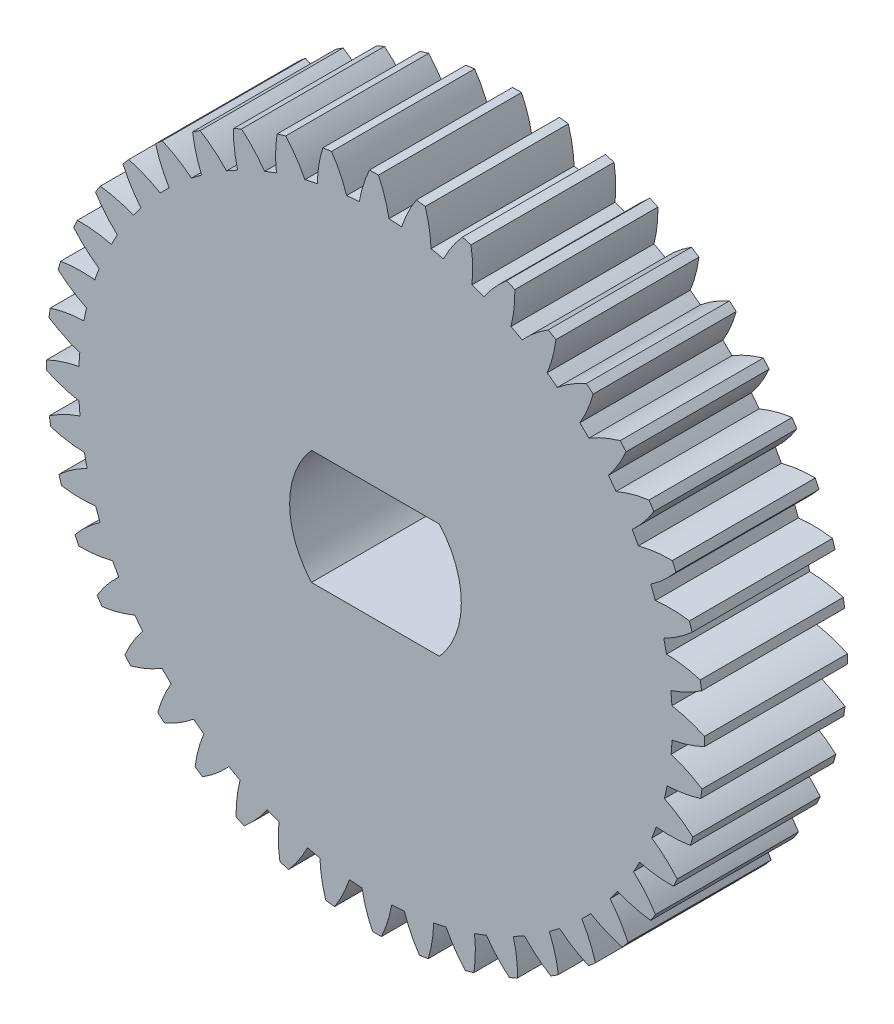
from build123d import *

# Parameters (mm, degrees)
SKETCH1_R               = 57.116275093
BOSS_EXTRUDE1_DEPTH     = 10
CUT_EXTRUDE5_DEPTH      = 305.133463075
CUT_EXTRUDE5_DEPTH_BACK = 305.133463075
SKETCH6_R               = 126.371127407


with BuildPart() as part:
    # Sketch1 → Boss-Extrude1 (new body)
    with BuildSketch(Plane.XY):
        Circle(SKETCH1_R)
    extrude(amount=BOSS_EXTRUDE1_DEPTH)

    # Sketch6 → Cut-Extrude5 (cut, two sides: drawn at the far end of the back side and taken through both)
    # profile 1 of 2: a face of its own
    with BuildSketch(Plane(origin=(-165.342018029, -142.968053491, -44.550276243), x_dir=(1, 0, 0), z_dir=(0, 0, 1)).offset(-CUT_EXTRUDE5_DEPTH_BACK)):
        with Locations((162.765212711, 169.489973714)):
            Circle(SKETCH6_R)
        with BuildLine():
            ThreePointArc((159.697417695, 192.28446063), (160.296052805, 191.248418205), (160.748606807, 190.140743715))
            ThreePointArc((160.748606807, 190.140743715), (161.19067309, 190.179145423), (161.633459483, 190.208085009))
            ThreePointArc((161.633459483, 190.208085009), (161.913174174, 191.371488461), (162.348127806, 192.486191668))
            ThreePointArc((162.348127806, 192.486191668), (162.660372812, 192.489734769), (162.972637144, 192.489038371))
            ThreePointArc((162.972637144, 192.489038371), (163.417734801, 191.378346706), (163.708043941, 190.217541595))
            ThreePointArc((163.708043941, 190.217541595), (164.151075759, 190.192639837), (164.593473758, 190.158269787))
            ThreePointArc((164.593473758, 190.158269787), (165.035910931, 191.270023918), (165.625076168, 192.311480698))
            ThreePointArc((165.625076168, 192.311480698), (165.934647206, 192.270550638), (166.243634029, 192.22542148))
            ThreePointArc((166.243634029, 192.22542148), (166.526133329, 191.062691053), (166.648287749, 189.872385967))
            ThreePointArc((166.648287749, 189.872385967), (167.083266253, 189.784687671), (167.516269909, 189.687707659))
            ThreePointArc((167.516269909, 189.687707659), (168.112422819, 190.725180361), (168.843805957, 191.672189657))
            ThreePointArc((168.843805957, 191.672189657), (169.144401054, 191.587619654), (169.443820287, 191.498976437))
            ThreePointArc((169.443820287, 191.498976437), (169.55797036, 190.307877087), (169.509483348, 189.112303203))
            ThreePointArc((169.509483348, 189.112303203), (169.927553628, 188.963593654), (170.342348237, 188.805977913))
            ThreePointArc((170.342348237, 188.805977913), (171.08008093, 189.748049235), (171.938793117, 190.581332668))
            ThreePointArc((171.938793117, 190.581332668), (172.224293023, 190.454844323), (172.508049355, 190.324491566))
            ThreePointArc((172.508049355, 190.324491566), (172.451526433, 189.129270641), (172.233385045, 187.952766397))
            ThreePointArc((172.233385045, 187.952766397), (172.626036397, 187.746072893), (173.014177937, 187.531030025))
            ThreePointArc((173.014177937, 187.531030025), (173.878472302, 188.35852211), (174.847032634, 189.061116434))
            ThreePointArc((174.847032634, 189.061116434), (175.111625394, 188.895284685), (175.373942365, 188.725875994))
            ThreePointArc((175.373942365, 188.725875994), (175.147897091, 187.550864745), (174.764542057, 186.417380374))
            ThreePointArc((174.764542057, 186.417380374), (175.123781233, 186.156910598), (175.47736826, 185.888818256))
            ThreePointArc((175.47736826, 185.888818256), (176.450629757, 186.584885752), (177.509321139, 187.142488171))
            ThreePointArc((177.509321139, 187.142488171), (177.747620407, 186.940688875), (177.983157999, 186.735672923))
            ThreePointArc((177.983157999, 186.735672923), (177.592192005, 185.604791191), (177.051427327, 184.537401167))
            ThreePointArc((177.051427327, 184.537401167), (177.369941252, 184.228457532), (177.681775754, 183.912773303))
            ThreePointArc((177.681775754, 183.912773303), (178.744191586, 184.463246283), (179.871462114, 184.864505621))
            ThreePointArc((179.871462114, 184.864505621), (180.078616806, 184.630846828), (180.282580152, 184.394397149))
            ThreePointArc((180.282580152, 184.394397149), (179.734652378, 183.330666424), (179.047486466, 182.351099729))
            ThreePointArc((179.047486466, 182.351099729), (179.318791114, 181.999971437), (179.582525041, 181.643121742))
            ThreePointArc((179.582525041, 181.643121742), (180.712467485, 182.036794163), (181.885369182, 182.273541937))
            ThreePointArc((181.885369182, 182.273541937), (182.057162224, 182.012780267), (182.22539922, 181.749710294))
            ThreePointArc((182.22539922, 181.749710294), (181.531663894, 180.774785067), (180.712085465, 179.902982854))
            ThreePointArc((180.712085465, 179.902982854), (180.930657857, 179.516817865), (181.140922346, 179.126067134))
            ThreePointArc((181.140922346, 179.126067134), (182.315389032, 179.354924961), (183.510045003, 179.422341669))
            ThreePointArc((183.510045003, 179.422341669), (183.642979184, 179.139785478), (183.77206501, 178.855450557))
            ThreePointArc((183.77206501, 178.855450557), (182.946644583, 177.989177494), (182.011337889, 177.242887142))
            ThreePointArc((182.011337889, 177.242887142), (182.172728522, 176.829546661), (182.325243195, 176.412849452))
            ThreePointArc((182.325243195, 176.412849452), (183.520325367, 176.4722338), (184.712415861, 176.368947032))
            ThreePointArc((184.712415861, 176.368947032), (184.803785026, 176.070348349), (184.891091865, 175.770536719))
            ThreePointArc((184.891091865, 175.770536719), (183.950789517, 175.030550641), (182.918794706, 174.42496447))
            ThreePointArc((182.918794706, 174.42496447), (183.019718131, 173.992862917), (183.111378228, 173.558701984))
            ThreePointArc((183.111378228, 173.558701984), (184.302747462, 173.447403959), (185.468004953, 173.175516335))
            ThreePointArc((185.468004953, 173.175516335), (185.515949088, 172.866953769), (185.559699626, 172.55776873))
            ThreePointArc((185.559699626, 172.55776873), (184.523657202, 171.95913362), (183.415982712, 171.506579618))
            ThreePointArc((183.415982712, 171.506579618), (183.454384419, 171.064513335), (183.483324006, 170.621726942))
            ThreePointArc((183.483324006, 170.621726942), (184.646727458, 170.342012251), (185.761430665, 169.907058619))
            ThreePointArc((185.761430665, 169.907058619), (185.764973766, 169.594813613), (185.764277368, 169.282549281))
            ThreePointArc((185.764277368, 169.282549281), (184.653585703, 168.837451624), (183.492780592, 168.547142484))
            ThreePointArc((183.492780592, 168.547142484), (183.467878834, 168.104110666), (183.433508784, 167.661712667))
            ThreePointArc((183.433508784, 167.661712667), (184.545262915, 167.219275495), (185.586719695, 166.630110257))
            ThreePointArc((185.586719695, 166.630110257), (185.545789635, 166.320539219), (185.500660477, 166.011552396))
            ThreePointArc((185.500660477, 166.011552396), (184.33793005, 165.729053096), (183.147624964, 165.606898676))
            ThreePointArc((183.147624964, 165.606898676), (183.059926668, 165.171920172), (182.962946656, 164.738916516))
            ThreePointArc((182.962946656, 164.738916516), (184.000419358, 164.142763606), (184.947428654, 163.411380468))
            ThreePointArc((184.947428654, 163.411380468), (184.862858651, 163.110785371), (184.774215433, 162.811366138))
            ThreePointArc((184.774215433, 162.811366138), (183.583116083, 162.697216065), (182.3875422, 162.745703077))
            ThreePointArc((182.3875422, 162.745703077), (182.238832651, 162.327632797), (182.08121691, 161.912838188))
            ThreePointArc((182.08121691, 161.912838188), (183.023288232, 161.175105495), (183.856571665, 160.316393308))
            ThreePointArc((183.856571665, 160.316393308), (183.73008332, 160.030893403), (183.599730563, 159.74713707))
            ThreePointArc((183.599730563, 159.74713707), (182.404509638, 159.803659992), (181.228005394, 160.02180138))
            ThreePointArc((181.228005394, 160.02180138), (181.02131189, 159.629150028), (180.806269022, 159.241008488))
            ThreePointArc((180.806269022, 159.241008488), (181.633761107, 158.376714123), (182.33635543, 157.408153791))
            ThreePointArc((182.33635543, 157.408153791), (182.170523681, 157.143561031), (182.001114991, 156.88124406))
            ThreePointArc((182.001114991, 156.88124406), (180.826103742, 157.107289334), (179.692619371, 157.490644368))
            ThreePointArc((179.692619371, 157.490644368), (179.432149595, 157.131405192), (179.164057253, 156.777818165))
            ThreePointArc((179.164057253, 156.777818165), (179.860124749, 155.804556668), (180.417727168, 154.745865286))
            ThreePointArc((180.417727168, 154.745865286), (180.215927872, 154.507566018), (180.01091192, 154.272028426))
            ThreePointArc((180.01091192, 154.272028426), (178.880030188, 154.66299442), (177.812640163, 155.203759098))
            ThreePointArc((177.812640163, 155.203759098), (177.503696529, 154.885245173), (177.1880123, 154.573410671))
            ThreePointArc((177.1880123, 154.573410671), (177.738485279, 153.510994839), (178.139744618, 152.383724311))
            ThreePointArc((178.139744618, 152.383724311), (177.906085825, 152.176569619), (177.669636146, 151.972606273))
            ThreePointArc((177.669636146, 151.972606273), (176.605905421, 152.520534048), (175.626338726, 153.207699959))
            ThreePointArc((175.626338726, 153.207699959), (175.275210434, 152.936395311), (174.918360739, 152.672661384))
            ThreePointArc((174.918360739, 152.672661384), (175.31203316, 151.54271894), (175.548780934, 150.369817243))
            ThreePointArc((175.548780934, 150.369817243), (175.288019264, 150.198024201), (175.024949291, 150.029787205))
            ThreePointArc((175.024949291, 150.029787205), (174.050024064, 150.723522531), (173.178221851, 151.54310096))
            ThreePointArc((173.178221851, 151.54310096), (172.792056862, 151.324528568), (172.401306131, 151.114264079))
            ThreePointArc((172.401306131, 151.114264079), (172.630163958, 149.939797393), (172.697580666, 148.745141422))
            ThreePointArc((172.697580666, 148.745141422), (172.415024475, 148.612207241), (172.130689554, 148.483121415))
            ThreePointArc((172.130689554, 148.483121415), (171.264416491, 149.308541842), (170.518126139, 150.243848536))
            ThreePointArc((170.518126139, 150.243848536), (170.104785658, 150.082457903), (169.688088449, 149.92994323))
            ThreePointArc((169.688088449, 149.92994323), (169.747472797, 148.734861058), (169.644186029, 147.542770564))
            ThreePointArc((169.644186029, 147.542770564), (169.345587346, 147.4514014), (169.045775716, 147.36409456))
            ThreePointArc((169.045775716, 147.36409456), (168.305789638, 148.304396908), (167.700203467, 149.336391719))
            ThreePointArc((167.700203467, 149.336391719), (167.268101914, 149.235468294), (166.833940981, 149.143808197))
            ThreePointArc((166.833940981, 149.143808197), (166.722642956, 147.952438963), (166.450755332, 146.787181472))
            ThreePointArc((166.450755332, 146.787181472), (166.142192766, 146.739237337), (165.833007727, 146.695486799))
            ThreePointArc((165.833007727, 146.695486799), (165.234372617, 147.731529223), (164.781818614, 148.839203713))
            ThreePointArc((164.781818614, 148.839203713), (164.339752332, 148.800802006), (163.896965938, 148.771862419))
            ThreePointArc((163.896965938, 148.771862419), (163.617251248, 147.608458967), (163.182297616, 146.49375576))
            ThreePointArc((163.182297616, 146.49375576), (162.87005261, 146.490212659), (162.557788278, 146.490909057))
            ThreePointArc((162.557788278, 146.490909057), (162.112690621, 147.601600723), (161.822381481, 148.762405833))
            ThreePointArc((161.822381481, 148.762405833), (161.379349663, 148.787307591), (160.936951664, 148.821677641))
            ThreePointArc((160.936951664, 148.821677641), (160.494514491, 147.70992351), (159.905349254, 146.66846673))
            ThreePointArc((159.905349254, 146.66846673), (159.595778216, 146.70939679), (159.286791393, 146.754525948))
            ThreePointArc((159.286791393, 146.754525948), (159.004292092, 147.917256375), (158.882137673, 149.107561461))
            ThreePointArc((158.882137673, 149.107561461), (158.447159169, 149.195259757), (158.014155513, 149.292239769))
            ThreePointArc((158.014155513, 149.292239769), (157.418002603, 148.254767067), (156.686619465, 147.307757771))
            ThreePointArc((156.686619465, 147.307757771), (156.386024368, 147.392327774), (156.086605134, 147.480970992))
            ThreePointArc((156.086605134, 147.480970992), (155.972455062, 148.672070342), (156.020942074, 149.867644225))
            ThreePointArc((156.020942074, 149.867644225), (155.602871794, 150.016353774), (155.188077185, 150.173969515))
            ThreePointArc((155.188077185, 150.173969515), (154.450344492, 149.231898194), (153.591632305, 148.39861476))
            ThreePointArc((153.591632305, 148.39861476), (153.306132399, 148.525103105), (153.022376067, 148.655455862))
            ThreePointArc((153.022376067, 148.655455862), (153.078898989, 149.850676787), (153.297040377, 151.027181031))
            ThreePointArc((153.297040377, 151.027181031), (152.904389024, 151.233874535), (152.516247485, 151.448917403))
            ThreePointArc((152.516247485, 151.448917403), (151.65195312, 150.621425318), (150.683392788, 149.918830995))
            ThreePointArc((150.683392788, 149.918830995), (150.418800028, 150.084662744), (150.156483057, 150.254071434))
            ThreePointArc((150.156483057, 150.254071434), (150.38252833, 151.429082683), (150.765883365, 152.562567054))
            ThreePointArc((150.765883365, 152.562567054), (150.406644189, 152.82303683), (150.053057162, 153.091129172))
            ThreePointArc((150.053057162, 153.091129172), (149.079795665, 152.395061676), (148.021104283, 151.837459257))
            ThreePointArc((148.021104283, 151.837459257), (147.782805015, 152.039258553), (147.547267423, 152.244274505))
            ThreePointArc((147.547267423, 152.244274505), (147.938233417, 153.375156237), (148.478998095, 154.442546262))
            ThreePointArc((148.478998095, 154.442546262), (148.16048417, 154.751489896), (147.848649668, 155.067174126))
            ThreePointArc((147.848649668, 155.067174126), (146.786233836, 154.516701146), (145.658963308, 154.115441807))
            ThreePointArc((145.658963308, 154.115441807), (145.451808616, 154.3491006), (145.24784527, 154.585550279))
            ThreePointArc((145.24784527, 154.585550279), (145.795773044, 155.649281004), (146.482938956, 156.628847699))
            ThreePointArc((146.482938956, 156.628847699), (146.211634307, 156.979975991), (145.947900381, 157.336825686))
            ThreePointArc((145.947900381, 157.336825686), (144.817957937, 156.943153265), (143.645056239, 156.706405491))
            ThreePointArc((143.645056239, 156.706405491), (143.473263198, 156.967167161), (143.305026201, 157.230237134))
            ThreePointArc((143.305026201, 157.230237134), (143.998761528, 158.205162361), (144.818339957, 159.076964574))
            ThreePointArc((144.818339957, 159.076964574), (144.599767565, 159.463129563), (144.389503075, 159.853880295))
            ThreePointArc((144.389503075, 159.853880295), (143.21503639, 159.625022467), (142.020380419, 159.557605759))
            ThreePointArc((142.020380419, 159.557605759), (141.887446238, 159.84016195), (141.758360412, 160.124496871))
            ThreePointArc((141.758360412, 160.124496871), (142.583780839, 160.990769934), (143.519087533, 161.737060286))
            ThreePointArc((143.519087533, 161.737060286), (143.3576969, 162.150400767), (143.205182227, 162.567097976))
            ThreePointArc((143.205182227, 162.567097976), (142.010100054, 162.507713628), (140.818009561, 162.611000397))
            ThreePointArc((140.818009561, 162.611000397), (140.726640396, 162.909599079), (140.639333557, 163.209410709))
            ThreePointArc((140.639333557, 163.209410709), (141.579635905, 163.949396787), (142.611630716, 164.554982958))
            ThreePointArc((142.611630716, 164.554982958), (142.510707291, 164.987084511), (142.419047193, 165.421245444))
            ThreePointArc((142.419047193, 165.421245444), (141.22767796, 165.532543469), (140.062420469, 165.804431093))
            ThreePointArc((140.062420469, 165.804431093), (140.014476334, 166.11299366), (139.970725796, 166.422178698))
            ThreePointArc((139.970725796, 166.422178698), (141.00676822, 167.020813808), (142.11444271, 167.473367811))
            ThreePointArc((142.11444271, 167.473367811), (142.076041002, 167.915434093), (142.047101416, 168.358220487))
            ThreePointArc((142.047101416, 168.358220487), (140.883697964, 168.637935177), (139.768994757, 169.072888809))
            ThreePointArc((139.768994757, 169.072888809), (139.765451656, 169.385133815), (139.766148054, 169.697398147))
            ThreePointArc((139.766148054, 169.697398147), (140.876839719, 170.142495804), (142.03764483, 170.432804944))
            ThreePointArc((142.03764483, 170.432804944), (142.062546588, 170.875836762), (142.096916638, 171.318234761))
            ThreePointArc((142.096916638, 171.318234761), (140.985162507, 171.760671934), (139.943705727, 172.349837171))
            ThreePointArc((139.943705727, 172.349837171), (139.984635787, 172.659408209), (140.029764945, 172.968395032))
            ThreePointArc((140.029764945, 172.968395032), (141.192495372, 173.250894333), (142.382800458, 173.373048752))
            ThreePointArc((142.382800458, 173.373048752), (142.470498754, 173.808027256), (142.567478766, 174.241030912))
            ThreePointArc((142.567478766, 174.241030912), (141.530006064, 174.837183822), (140.582996768, 175.56856696))
            ThreePointArc((140.582996768, 175.56856696), (140.667566771, 175.869162057), (140.756209988, 176.168581291))
            ThreePointArc((140.756209988, 176.168581291), (141.947309339, 176.282731363), (143.142883222, 176.234244351))
            ThreePointArc((143.142883222, 176.234244351), (143.291592771, 176.652314632), (143.449208512, 177.06710924))
            ThreePointArc((143.449208512, 177.06710924), (142.50713719, 177.804841933), (141.673853757, 178.66355412))
            ThreePointArc((141.673853757, 178.66355412), (141.800342102, 178.949054026), (141.930694859, 179.232810358))
            ThreePointArc((141.930694859, 179.232810358), (143.125915784, 179.176287436), (144.302420028, 178.958146048))
            ThreePointArc((144.302420028, 178.958146048), (144.509113532, 179.350797401), (144.7241564, 179.73893894))
            ThreePointArc((144.7241564, 179.73893894), (143.896664315, 180.603233305), (143.194069992, 181.571793637))
            ThreePointArc((143.194069992, 181.571793637), (143.35990174, 181.836386397), (143.529310431, 182.098703368))
            ThreePointArc((143.529310431, 182.098703368), (144.70432168, 181.872658095), (145.837806051, 181.48930306))
            ThreePointArc((145.837806051, 181.48930306), (146.098275827, 181.848542236), (146.366368169, 182.202129263))
            ThreePointArc((146.366368169, 182.202129263), (145.670300673, 183.17539076), (145.112698254, 184.234082142))
            ThreePointArc((145.112698254, 184.234082142), (145.31449755, 184.47238141), (145.519513502, 184.707919002))
            ThreePointArc((145.519513502, 184.707919002), (146.650395234, 184.316953008), (147.717785258, 183.77618833))
            ThreePointArc((147.717785258, 183.77618833), (148.026728893, 184.094702255), (148.342413122, 184.406536757))
            ThreePointArc((148.342413122, 184.406536757), (147.791940142, 185.468952589), (147.390680804, 186.596223117))
            ThreePointArc((147.390680804, 186.596223117), (147.624339597, 186.803377809), (147.860789276, 187.007341155))
            ThreePointArc((147.860789276, 187.007341155), (148.924520001, 186.459413381), (149.904086696, 185.772247469))
            ThreePointArc((149.904086696, 185.772247469), (150.255214988, 186.043552118), (150.612064683, 186.307286045))
            ThreePointArc((150.612064683, 186.307286045), (150.218392262, 187.437228488), (149.981644488, 188.610130186))
            ThreePointArc((149.981644488, 188.610130186), (150.242406158, 188.781923228), (150.505476131, 188.950160224))
            ThreePointArc((150.505476131, 188.950160224), (151.480401358, 188.256424897), (152.352203571, 187.436846468))
            ThreePointArc((152.352203571, 187.436846468), (152.73836856, 187.655418861), (153.129119291, 187.86568335))
            ThreePointArc((153.129119291, 187.86568335), (152.900261464, 189.040150035), (152.832844756, 190.234806006))
            ThreePointArc((152.832844756, 190.234806006), (153.115400947, 190.367740188), (153.399735868, 190.496826013))
            ThreePointArc((153.399735868, 190.496826013), (154.266008931, 189.671405586), (155.012299283, 188.736098892))
            ThreePointArc((155.012299283, 188.736098892), (155.425639764, 188.897489525), (155.842336973, 189.050004198))
            ThreePointArc((155.842336973, 189.050004198), (155.782952625, 190.245086371), (155.886239393, 191.437176864))
            ThreePointArc((155.886239393, 191.437176864), (156.184838076, 191.528546029), (156.484649706, 191.615852868))
            ThreePointArc((156.484649706, 191.615852868), (157.224635784, 190.67555052), (157.830221955, 189.643555709))
            ThreePointArc((157.830221955, 189.643555709), (158.262323508, 189.744479134), (158.696484441, 189.836139232))
            ThreePointArc((158.696484441, 189.836139232), (158.807782466, 191.027508465), (159.07967009, 192.192765956))
            ThreePointArc((159.07967009, 192.192765956), (159.388232656, 192.240710091), (159.697417695, 192.28446063))
        make_face(mode=Mode.SUBTRACT)
    # profile 2 of 2: a face of its own
    with BuildSketch(Plane(origin=(-165.342018029, -142.968053491, -44.550276243), x_dir=(1, 0, 0), z_dir=(0, 0, 1)).offset(-CUT_EXTRUDE5_DEPTH_BACK)):
        with BuildLine():
            Line((167.237348666, 173.489973714), (158.293076756, 173.489973714))
            ThreePointArc((158.293076756, 173.489973714), (156.765212711, 169.489973714), (158.293076756, 165.489973714))
            Line((158.293076756, 165.489973714), (167.237348666, 165.489973714))
            ThreePointArc((167.237348666, 165.489973714), (168.765212711, 169.489973714), (167.237348666, 173.489973714))
        make_face()
    extrude(amount=CUT_EXTRUDE5_DEPTH + CUT_EXTRUDE5_DEPTH_BACK, mode=Mode.SUBTRACT)


solid = part.part
